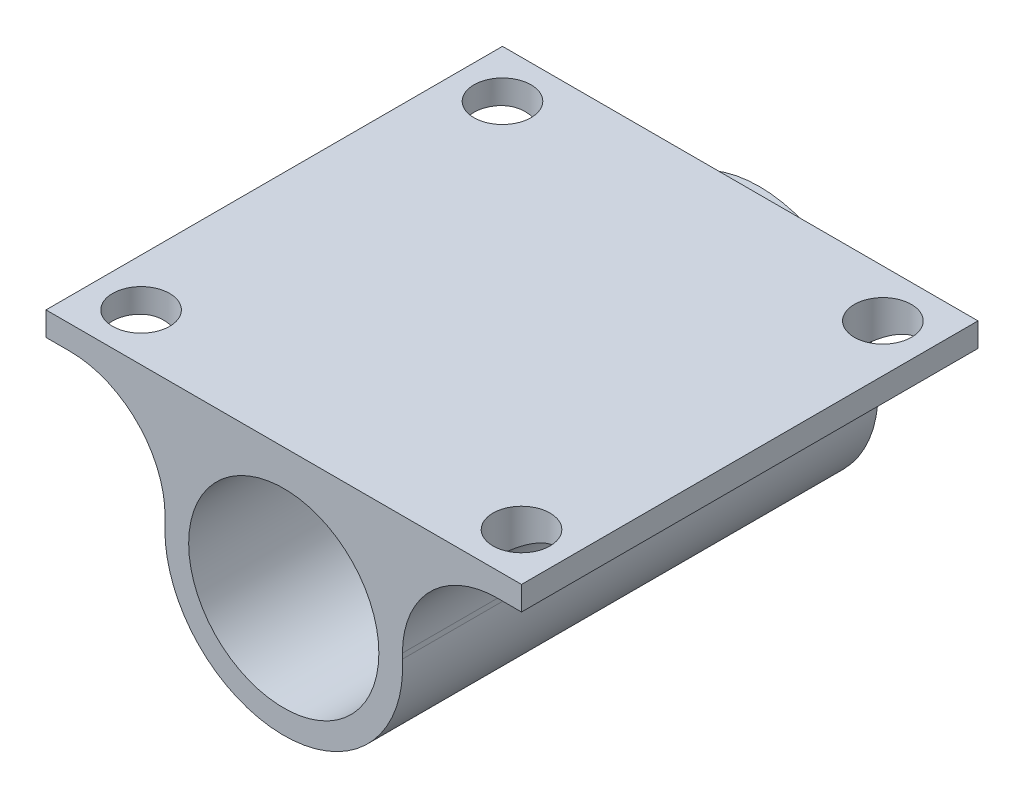
from build123d import *

# Parameters (mm, degrees)
SKETCH1_R           = 10
BOSS_EXTRUDE1_DEPTH = 48
BOSS_EXTRUDE3_START = 2
SKETCH3_R           = 12.5
SKETCH3_R_2         = 3.5
SKETCH3_R_3         = 0.95
BOSS_EXTRUDE3_DEPTH = 2
SKETCH4_R           = 3
CUT_EXTRUDE1_DEPTH  = 61.153219082


with BuildPart() as part:
    # Sketch1 → Boss-Extrude1 (new body)
    with BuildSketch(Plane.XY):
        with BuildLine():
            Line((-25, 11.243386243), (-25, 13.756613757))
            Line((-25, 13.756613757), (25, 13.756613757))
            Line((25, 13.756613757), (25, 11.243386243))
            Line((25, 11.243386243), (22.480898871, 11.243386243))
            ThreePointArc((22.480898871, 11.243386243), (15.409831059, 8.314454055), (12.480898871, 1.243386243))
            Line((12.480898871, 1.243386243), (12.480898871, 0.690770135))
            ThreePointArc((12.480898871, 0.690770135), (0, -12.5), (-12.480898871, 0.690770135))
            Line((-12.480898871, 0.690770135), (-12.480898871, 1.243386243))
            ThreePointArc((-12.480898871, 1.243386243), (-15.409831059, 8.314454055), (-22.480898871, 11.243386243))
            Line((-22.480898871, 11.243386243), (-25, 11.243386243))
        make_face()
        Circle(SKETCH1_R, mode=Mode.SUBTRACT)
    extrude(amount=BOSS_EXTRUDE1_DEPTH)

    # Sketch3 → Boss-Extrude3 (add)
    with BuildSketch(Plane(origin=(0, 0, 0), x_dir=(-1, 0, 0), z_dir=(0, 0, -1)).offset(BOSS_EXTRUDE3_START)):
        Circle(SKETCH3_R)
        Circle(SKETCH3_R_2, mode=Mode.SUBTRACT)
        with Locations((7.5, 0)):
            Circle(SKETCH3_R_3, mode=Mode.SUBTRACT)
        with Locations((-7.5, 0)):
            Circle(SKETCH3_R_3, mode=Mode.SUBTRACT)
    extrude(amount=-BOSS_EXTRUDE3_DEPTH)

    # Sketch4 → Cut-Extrude1 (cut, through all)
    with BuildSketch(Plane(origin=(0, 13.756613757, 0), x_dir=(1, 0, 0), z_dir=(0, 1, 0))):
        with Locations((-20, -5)):
            Circle(SKETCH4_R)
        with Locations((20, -5)):
            Circle(SKETCH4_R)
        with Locations((20, -43)):
            Circle(SKETCH4_R)
        with Locations((-20, -43)):
            Circle(SKETCH4_R)
    extrude(amount=-CUT_EXTRUDE1_DEPTH, mode=Mode.SUBTRACT)


solid = part.part
